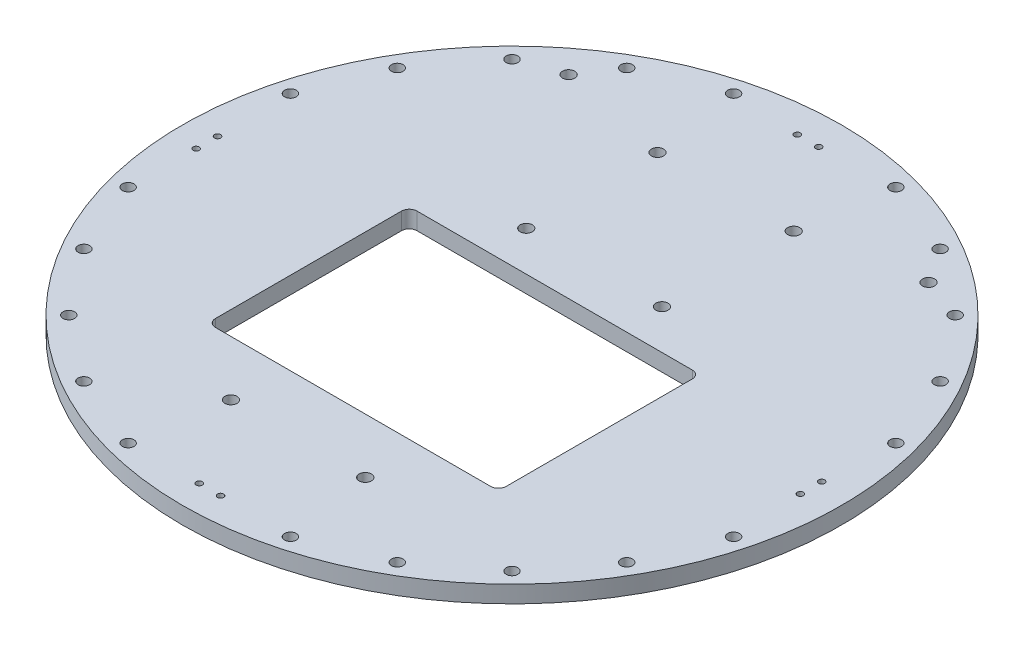
from build123d import *

# Parameters (mm, degrees)
ESQUISSE1_R             = 107.95
BOSS_EXTRU_1_DEPTH      = 5.588
ESQUISSE2_R             = 1.905
ENL_V_MAT_EXTRU_1_DEPTH = 5.588
ENL_V_MAT_EXTRU_2_DEPTH = 5.588
ESQUISSE5_R             = 1
ENL_V_MAT_EXTRU_3_DEPTH = 153.766589096
ESQUISSE6_R             = 2
ENL_V_MAT_EXTRU_4_DEPTH = 153.766589096


with BuildPart() as part:
    # Esquisse1 → Boss.-Extru.1 (new body)
    with BuildSketch(Plane(origin=(0, 0, 0), x_dir=(1, 0, 0), z_dir=(0, 1, 0))):
        Circle(ESQUISSE1_R)
    extrude(amount=BOSS_EXTRU_1_DEPTH)

    # Esquisse2 → Enlèv. mat.-Extru.1 (cut)
    with BuildSketch(Plane(origin=(0, 5.588, 0), x_dir=(1, 0, 0), z_dir=(0, 1, 0))):
        with Locations((26.569931805, 99.16033545)):
            Circle(ESQUISSE2_R)
        with Locations((51.329166667, 88.904724577)):
            Circle(ESQUISSE2_R)
        with Locations((72.590403645, 72.590403645)):
            Circle(ESQUISSE2_R)
        with Locations((88.904724577, 51.329166667)):
            Circle(ESQUISSE2_R)
        with Locations((99.16033545, 26.569931805)):
            Circle(ESQUISSE2_R)
        with Locations((99.16033545, -26.569931805)):
            Circle(ESQUISSE2_R)
        with Locations((88.904724577, -51.329166667)):
            Circle(ESQUISSE2_R)
        with Locations((72.590403645, -72.590403645)):
            Circle(ESQUISSE2_R)
        with Locations((51.329166667, -88.904724577)):
            Circle(ESQUISSE2_R)
        with Locations((26.569931805, -99.16033545)):
            Circle(ESQUISSE2_R)
        with Locations((-26.569931805, -99.16033545)):
            Circle(ESQUISSE2_R)
        with Locations((-51.329166667, -88.904724577)):
            Circle(ESQUISSE2_R)
        with Locations((-72.590403645, -72.590403645)):
            Circle(ESQUISSE2_R)
        with Locations((-88.904724577, -51.329166667)):
            Circle(ESQUISSE2_R)
        with Locations((-99.16033545, -26.569931805)):
            Circle(ESQUISSE2_R)
        with Locations((-99.16033545, 26.569931805)):
            Circle(ESQUISSE2_R)
        with Locations((-88.904724577, 51.329166667)):
            Circle(ESQUISSE2_R)
        with Locations((-72.590403645, 72.590403645)):
            Circle(ESQUISSE2_R)
        with Locations((-51.329166667, 88.904724577)):
            Circle(ESQUISSE2_R)
        with Locations((-26.569931805, 99.16033545)):
            Circle(ESQUISSE2_R)
    extrude(amount=-ENL_V_MAT_EXTRU_1_DEPTH, mode=Mode.SUBTRACT)

    # Esquisse3 → Enlèv. mat.-Extru.2 (cut)
    with BuildSketch(Plane(origin=(0, 5.588, 0), x_dir=(1, 0, 0), z_dir=(0, 1, 0))):
        with BuildLine():
            Line((-45.085, -52.07), (45.085, -52.07))
            ThreePointArc((45.085, -52.07), (46.881051224, -51.326051224), (47.625, -49.53))
            Line((47.625, -49.53), (47.625, 11.43))
            ThreePointArc((47.625, 11.43), (46.881051224, 13.226051224), (45.085, 13.97))
            Line((45.085, 13.97), (-45.085, 13.97))
            ThreePointArc((-45.085, 13.97), (-46.881051224, 13.226051224), (-47.625, 11.43))
            Line((-47.625, 11.43), (-47.625, -49.53))
            ThreePointArc((-47.625, -49.53), (-46.881051224, -51.326051224), (-45.085, -52.07))
        make_face()
    extrude(amount=-ENL_V_MAT_EXTRU_2_DEPTH, mode=Mode.SUBTRACT)

    # Esquisse5 → Enlèv. mat.-Extru.3 (cut, through all)
    with BuildSketch(Plane(origin=(0, 5.588, 0), x_dir=(1, 0, 0), z_dir=(0, 1, 0))):
        with Locations((-3.5, -98.95)):
            Circle(ESQUISSE5_R)
        with Locations((3.5, -98.95)):
            Circle(ESQUISSE5_R)
        with Locations((-98.95, 2.5)):
            Circle(ESQUISSE5_R)
        with Locations((-98.95, -4.5)):
            Circle(ESQUISSE5_R)
        with Locations((2.5, 97.95)):
            Circle(ESQUISSE5_R)
        with Locations((-4.5, 97.95)):
            Circle(ESQUISSE5_R)
        with Locations((97.95, -3.5)):
            Circle(ESQUISSE5_R)
        with Locations((97.95, 3.5)):
            Circle(ESQUISSE5_R)
    extrude(amount=-ENL_V_MAT_EXTRU_3_DEPTH, mode=Mode.SUBTRACT)

    # Esquisse6 → Enlèv. mat.-Extru.4 (cut, through all)
    with BuildSketch(Plane(origin=(0, 5.588, 0), x_dir=(1, 0, 0), z_dir=(0, 1, 0))):
        with Locations((-22, -70.07)):
            Circle(ESQUISSE6_R)
        with Locations((22, -70.07)):
            Circle(ESQUISSE6_R)
        with Locations((-22.3, 69.97)):
            Circle(ESQUISSE6_R)
        with Locations((22.3, 69.97)):
            Circle(ESQUISSE6_R)
        with Locations((-58.95, 77.5)):
            Circle(ESQUISSE6_R)
        with Locations((58.95, 77.5)):
            Circle(ESQUISSE6_R)
        with Locations((-22.3, 26.97)):
            Circle(ESQUISSE6_R)
        with Locations((22.15, 26.97)):
            Circle(ESQUISSE6_R)
    extrude(amount=-ENL_V_MAT_EXTRU_4_DEPTH, mode=Mode.SUBTRACT)


solid = part.part
